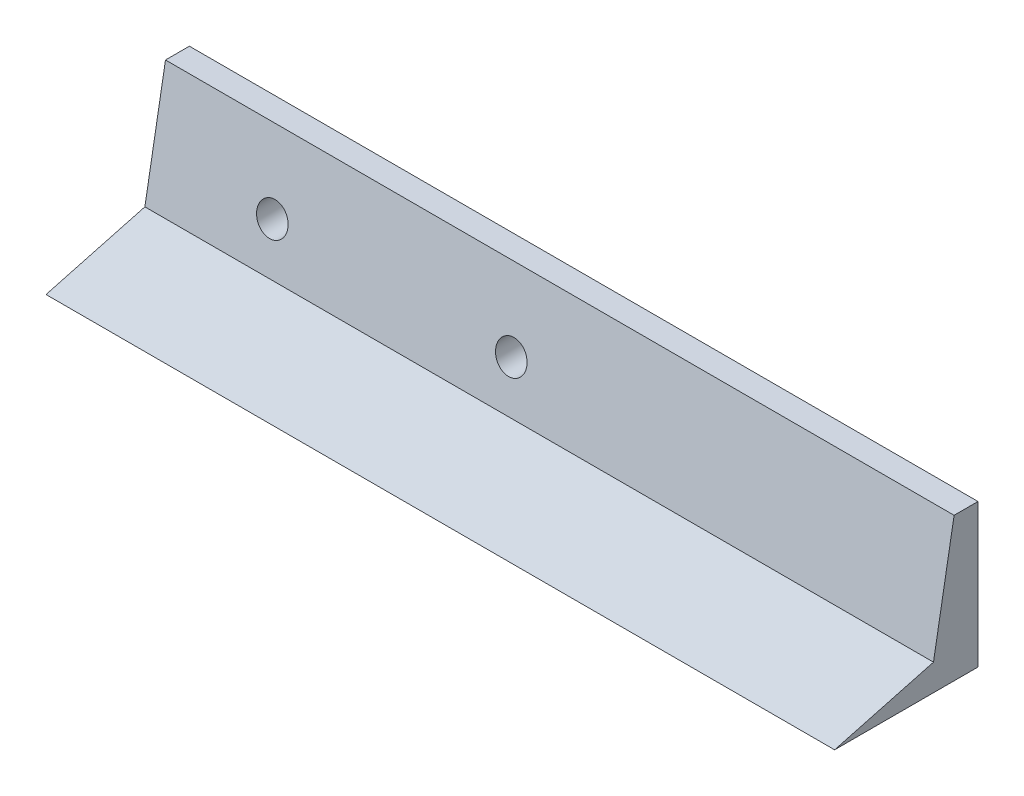
from build123d import *

# Parameters (mm, degrees)
BOSS_EXTRUDE1_DEPTH  = 100
M3_CLEARANCE_HOLE1_D = 3.4
SKETCH4_R            = 3.25
CUT_EXTRUDE1_DEPTH   = 108.964114408
BOSS_EXTRUDE2_DEPTH  = 65


with BuildPart() as part:
    # Sketch1 → Boss-Extrude1 (new body)
    with BuildSketch(Plane(origin=(0, 0, 0), x_dir=(0, 0, -1), z_dir=(1, 0, 0))):
        Polygon((0, 0), (0, 30), (-5, 30), (-9.312388631, 5.54322876), (-30, 0), align=None)
    extrude(amount=BOSS_EXTRUDE1_DEPTH)

    # M3 Clearance Hole1 (through all)
    with Locations(Plane(origin=(0, 0, 0), x_dir=(-1, 0, 0), z_dir=(0, 0, -1))):
        with Locations((-25, 15), (-75, 15)):
            Hole(M3_CLEARANCE_HOLE1_D / 2)

    # Sketch4 → Cut-Extrude1 (cut, through all)
    with BuildSketch(Plane(origin=(0, 0, 2.5), x_dir=(-1, 0, 0), z_dir=(0, 0, -1))):
        with Locations((-75, 15)):
            Circle(SKETCH4_R)
        with Locations((-25, 15)):
            Circle(SKETCH4_R)
    extrude(amount=-CUT_EXTRUDE1_DEPTH, mode=Mode.SUBTRACT)

    # Sketch6 → Boss-Extrude2 (add)
    with BuildSketch(Plane.ZY.offset(-100)):
        Polygon((0, 0), (30, 0), (9.312388631, 5.54322876), (5, 30), (0, 30), align=None)
    extrude(amount=-BOSS_EXTRUDE2_DEPTH)


solid = part.part
